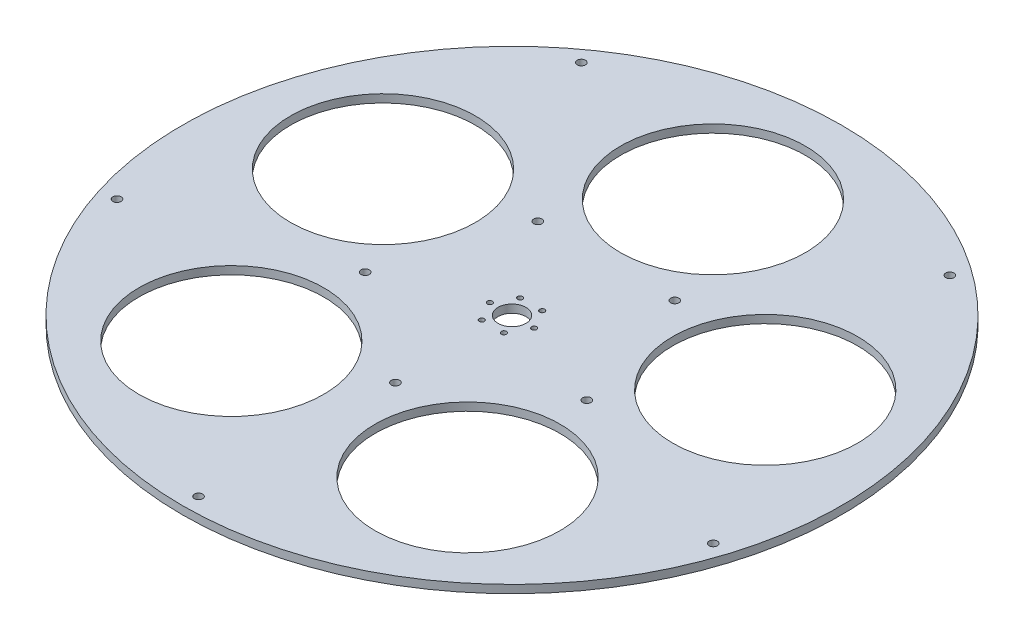
from build123d import *

# Parameters (mm, degrees)
SKETCH1_R              = 260.35
SKETCH1_R_2            = 73.025
BOSS_EXTRUDE1_DEPTH    = 6.35
SKETCH3_R              = 11
CUT_EXTRUDE1_DEPTH     = 374.646887366
F_10_32_TAPPED_HOLE1_D = 4.0386
SKETCH8_R              = 3.2512
CUT_EXTRUDE2_DEPTH     = 369.245254552
SKETCH9_R              = 3.2639
CUT_EXTRUDE3_DEPTH     = 369.245254552
CIRPATTERN1_COUNT      = 5


with BuildPart() as part:
    # Sketch1 → Boss-Extrude1 (new body)
    with BuildSketch(Plane(origin=(0, 0, 0), x_dir=(1, 0, 0), z_dir=(0, 1, 0))):
        Circle(SKETCH1_R)
        with Locations((0, 158.75)):
            Circle(SKETCH1_R_2, mode=Mode.SUBTRACT)
        with Locations((150.980221962, 49.056447857)):
            Circle(SKETCH1_R_2, mode=Mode.SUBTRACT)
        with Locations((93.310908801, -128.431447857)):
            Circle(SKETCH1_R_2, mode=Mode.SUBTRACT)
        with Locations((-93.310908801, -128.431447857)):
            Circle(SKETCH1_R_2, mode=Mode.SUBTRACT)
        with Locations((-150.980221962, 49.056447857)):
            Circle(SKETCH1_R_2, mode=Mode.SUBTRACT)
    extrude(amount=BOSS_EXTRUDE1_DEPTH)

    # Sketch3 → Cut-Extrude1 (cut, through all)
    with BuildSketch(Plane(origin=(-5.184519995, 6.35, -2.448578058), x_dir=(1, 0, 0), z_dir=(0, 1, 0))):
        with Locations((5.184519995, -2.448578058)):
            Circle(SKETCH3_R)
    extrude(amount=-CUT_EXTRUDE1_DEPTH, mode=Mode.SUBTRACT)

    # #10-32 Tapped Hole1 (through all)
    with Locations(Plane(origin=(-5.184519995, 6.35, -2.448578058), x_dir=(1, 0, 0), z_dir=(0, 1, 0))):
        with Locations((-3.546730005, 12.674390556), (13.915769995, 12.674390556), (22.647019995, -2.448578058), (13.915769995, -17.571546671), (-3.546730005, -17.571546671), (-12.277980005, -2.448578058)):
            Hole(F_10_32_TAPPED_HOLE1_D / 2)

    # Sketch8 → Cut-Extrude2 (cut, through all)
    with BuildSketch(Plane(origin=(0, 6.35, 0), x_dir=(1, 0, 0), z_dir=(0, 1, 0))):
        with Locations((0, -247.65)):
            Circle(SKETCH8_R)
        with Locations((-235.52914626, -76.528058657)):
            Circle(SKETCH8_R)
        with Locations((-145.56501773, 200.353058657)):
            Circle(SKETCH8_R)
        with Locations((145.56501773, 200.353058657)):
            Circle(SKETCH8_R)
        with Locations((235.52914626, -76.528058657)):
            Circle(SKETCH8_R)
    extrude(amount=-CUT_EXTRUDE2_DEPTH, mode=Mode.SUBTRACT)

    # Sketch9 → Cut-Extrude3 (cut, through all)
    with BuildSketch(Plane(origin=(0, 6.35, 0), x_dir=(1, 0, 0), z_dir=(0, 1, 0))):
        with Locations((0, -92.075)):
            Circle(SKETCH9_R)
    cut_extrude3 = extrude(amount=-CUT_EXTRUDE3_DEPTH, mode=Mode.SUBTRACT)

    # CirPattern1: Cut-Extrude3 ×5 about axis
    cirpattern1_axis = Axis((0, 6.35, 0), (0, 1, 0))
    for i in range(1, CIRPATTERN1_COUNT):
        add(cut_extrude3.rotate(cirpattern1_axis, i * 360 / CIRPATTERN1_COUNT), mode=Mode.SUBTRACT)


solid = part.part
